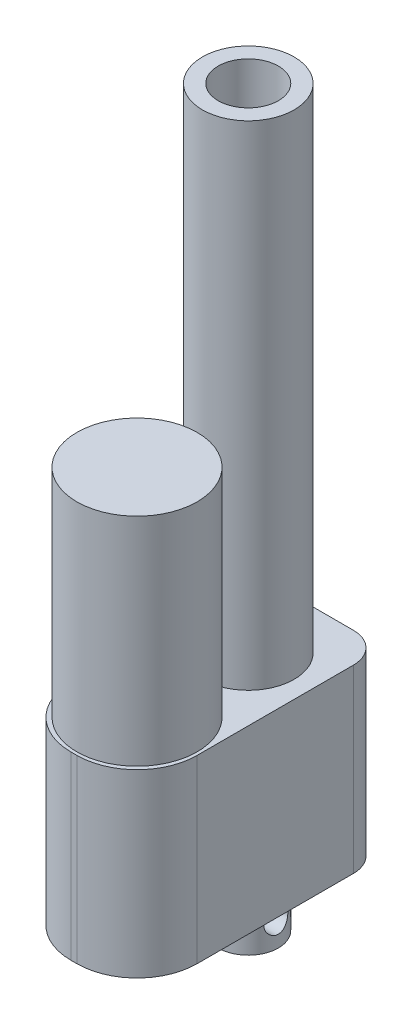
from build123d import *

# Parameters (mm, degrees)
SKETCH1_R      = 15.25
EXTRUDE1_DEPTH = 164
EXTRUDE2_DEPTH = 60
SKETCH3_R      = 20
EXTRUDE3_DEPTH = 72
SKETCH4_R      = 10
EXTRUDE4_DEPTH = 20
SKETCH5_R      = 4
EXTRUDE5_DEPTH = 15
SKETCH6_R      = 10
EXTRUDE6_DEPTH = 150
FILLET_1_R     = 10


with BuildPart() as part:
    # Sketch1 → Extrude1 (new body)
    with BuildSketch(Plane(origin=(0, 0, 0), x_dir=(1, 0, 0), z_dir=(0, 1, 0))):
        Circle(SKETCH1_R)
    extrude(amount=EXTRUDE1_DEPTH)

    # Sketch2 → Extrude2 (add)
    with BuildSketch(Plane.XZ):
        with BuildLine():
            Line((-1, 58), (1, 58))
            ThreePointArc((1, 58), (15.142135624, 52.142135624), (21, 38))
            Line((21, 38), (21, -24))
            Line((21, -24), (-21, -24))
            Line((-21, -24), (-21, 38))
            ThreePointArc((-21, 38), (-15.142135624, 52.142135624), (-1, 58))
        make_face()
    extrude(amount=EXTRUDE2_DEPTH)

    # Sketch3 → Extrude3 (add)
    with BuildSketch(Plane(origin=(0, 0, 0), x_dir=(1, 0, 0), z_dir=(0, 1, 0))):
        with Locations((0, -37)):
            Circle(SKETCH3_R)
    extrude(amount=EXTRUDE3_DEPTH)

    # Sketch4 → Extrude4 (add)
    with BuildSketch(Plane.XZ.offset(60)):
        Circle(SKETCH4_R)
    extrude(amount=EXTRUDE4_DEPTH)

    # Sketch5 → Extrude5 (cut, symmetric)
    with BuildSketch(Plane(origin=(0, 0, 0), x_dir=(0, 0, -1), z_dir=(1, 0, 0))):
        with Locations((0, -72)):
            Circle(SKETCH5_R)
    extrude(amount=EXTRUDE5_DEPTH, both=True, mode=Mode.SUBTRACT)

    # Sketch6 → Extrude6 (cut)
    with BuildSketch(Plane(origin=(0, 164, 0), x_dir=(1, 0, 0), z_dir=(0, 1, 0))):
        Circle(SKETCH6_R)
    extrude(amount=-EXTRUDE6_DEPTH, mode=Mode.SUBTRACT)

    # Скругление1
    fillet_1_edges = [part.edges().sort_by_distance(p)[0] for p in [
        (21, -30, -24),
        (-21, -30, -24),
    ]]
    fillet(fillet_1_edges, radius=FILLET_1_R)


solid = part.part
